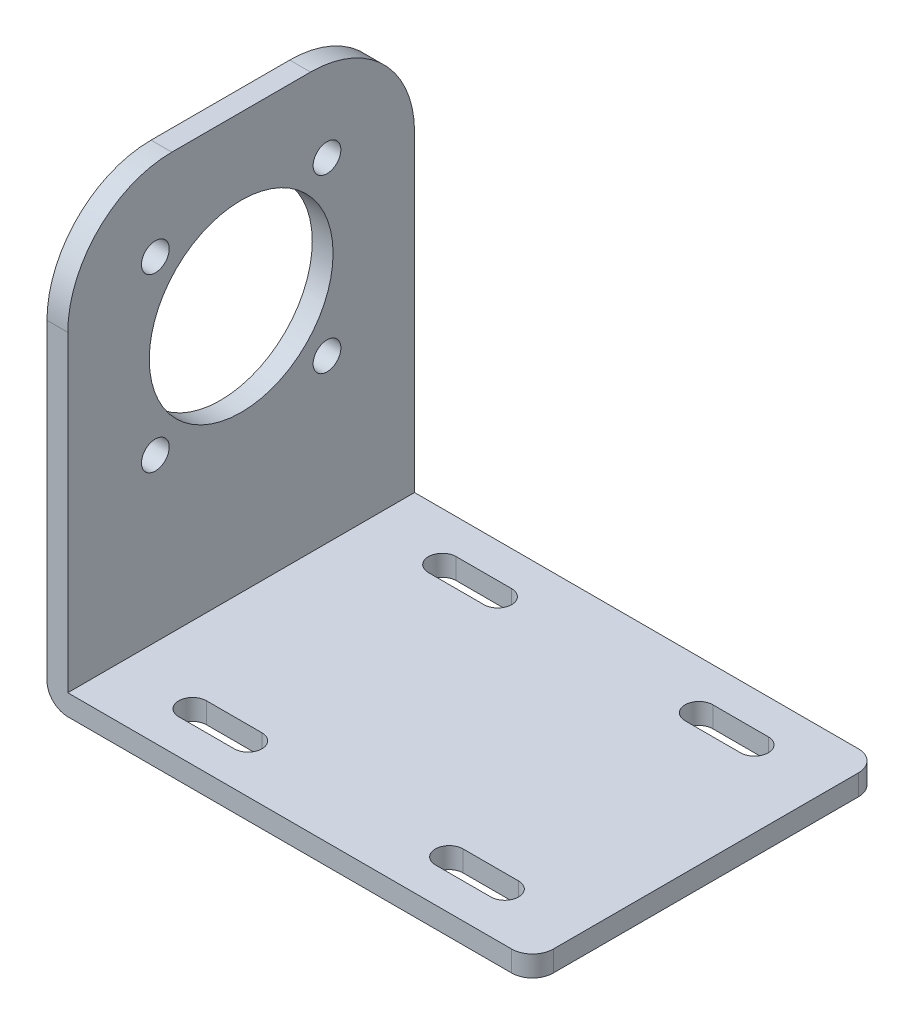
from build123d import *

# Parameters (mm, degrees)
SKETCH1_W           = 70
SKETCH1_H           = 50
BOSS_EXTRUDE1_DEPTH = 3
SKETCH2_W           = 3
SKETCH2_H           = 50
BOSS_EXTRUDE2_DEPTH = 60
SKETCH3_R           = 13.25
SKETCH3_R_2         = 2
CUT_EXTRUDE1_DEPTH  = 60
FILLET1_R           = 15
FILLET2_R           = 3


with BuildPart() as part:
    # Sketch1 → Boss-Extrude1 (new body)
    with BuildSketch(Plane(origin=(0, 0, 0), x_dir=(1, 0, 0), z_dir=(0, 1, 0))):
        with Locations((35, 25)):
            Rectangle(SKETCH1_W, SKETCH1_H)
        with BuildLine():
            Line((14, 45), (22, 45))
            ThreePointArc((22, 45), (24, 43), (22, 41))
            Line((22, 41), (14, 41))
            ThreePointArc((14, 41), (12, 43), (14, 45))
        make_face(mode=Mode.SUBTRACT)
        with BuildLine():
            Line((51, 45), (59, 45))
            ThreePointArc((59, 45), (61, 43), (59, 41))
            Line((59, 41), (51, 41))
            ThreePointArc((51, 41), (49, 43), (51, 45))
        make_face(mode=Mode.SUBTRACT)
        with BuildLine():
            Line((51, 5), (59, 5))
            ThreePointArc((59, 5), (61, 7), (59, 9))
            Line((59, 9), (51, 9))
            ThreePointArc((51, 9), (49, 7), (51, 5))
        make_face(mode=Mode.SUBTRACT)
        with BuildLine():
            Line((14, 5), (22, 5))
            ThreePointArc((22, 5), (24, 7), (22, 9))
            Line((22, 9), (14, 9))
            ThreePointArc((14, 9), (12, 7), (14, 5))
        make_face(mode=Mode.SUBTRACT)
    extrude(amount=BOSS_EXTRUDE1_DEPTH)

    # Sketch2 → Boss-Extrude2 (add)
    with BuildSketch(Plane(origin=(0, 3, 0), x_dir=(1, 0, 0), z_dir=(0, 1, 0))):
        with Locations((1.5, 25)):
            Rectangle(SKETCH2_W, SKETCH2_H)
    extrude(amount=BOSS_EXTRUDE2_DEPTH)

    # Sketch3 → Cut-Extrude1 (cut)
    with BuildSketch(Plane.ZY):
        with Locations((-25, 38.75)):
            Circle(SKETCH3_R)
        with Locations((-12.625631329, 51.124368671)):
            Circle(SKETCH3_R_2)
        with Locations((-12.625631329, 26.375631329)):
            Circle(SKETCH3_R_2)
        with Locations((-37.374368671, 26.375631329)):
            Circle(SKETCH3_R_2)
        with Locations((-37.374368671, 51.124368671)):
            Circle(SKETCH3_R_2)
    extrude(amount=-CUT_EXTRUDE1_DEPTH, mode=Mode.SUBTRACT)

    # Fillet1
    fillet1_edges = [part.edges().sort_by_distance(p)[0] for p in [
        (1.5, 63, -50),
        (1.5, 63, 0),
    ]]
    fillet(fillet1_edges, radius=FILLET1_R)

    # Fillet2
    fillet2_edges = [part.edges().sort_by_distance(p)[0] for p in [
        (0, 0, -25),
        (70, 1.5, 0),
        (70, 1.5, -50),
    ]]
    fillet(fillet2_edges, radius=FILLET2_R)


solid = part.part
